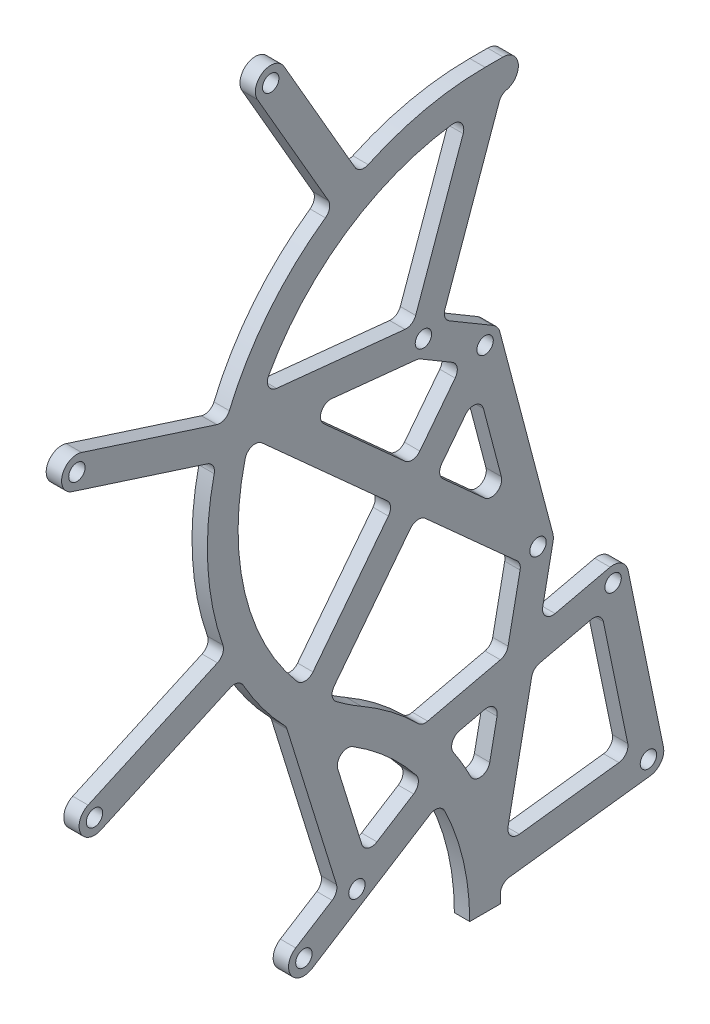
from build123d import *

# Parameters (mm, degrees)
SKETCH2_W             = 3
SKETCH2_H             = 6
SKETCH3_R             = 3
SKETCH3_R_2           = 1.6
BOSS_EXTRUDE1_DEPTH   = 3
BOSS_EXTRUDE1_2_DEPTH = 3
BOSS_EXTRUDE1_3_DEPTH = 3
SKETCH5_W             = 6.5
SKETCH5_H             = 6
BOSS_EXTRUDE2_DEPTH   = 3
FILLET1_R             = 3
SKETCH6_R             = 3
SKETCH6_R_2           = 1.6
BOSS_EXTRUDE3_DEPTH   = 3
BOSS_EXTRUDE3_2_DEPTH = 3
BOSS_EXTRUDE3_3_DEPTH = 3
BOSS_EXTRUDE3_4_DEPTH = 3
BOSS_EXTRUDE3_5_DEPTH = 3
BOSS_EXTRUDE3_6_DEPTH = 3
BOSS_EXTRUDE3_7_DEPTH = 3
BOSS_EXTRUDE4_START   = -3
SKETCH7_R             = 1.6
BOSS_EXTRUDE4_DEPTH   = 3
FILLET2_R             = 2
SKETCH8_R             = 1.6
BOSS_EXTRUDE7_DEPTH   = 3
FILLET3_R             = 2
BOSS_EXTRUDE8_START   = -3
BOSS_EXTRUDE8_DEPTH   = 3
FILLET4_R             = 2


with BuildPart() as part:
    # Sweep1: sweep along a path in Sketch1
    with BuildLine(Plane(origin=(0, 0, 0), x_dir=(0, 0, -1), z_dir=(1, 0, 0))) as sweep1_path:
        ThreePointArc((0, 140), (-49.497474683, 102.019251839), (-25.621778265, 44.378221735))
        ThreePointArc((-25.621778265, 44.378221735), (-6.865334795, 25.621778265), (0, 0))
    # Sketch2 → Sweep1 (sweep)
    with BuildSketch(Plane(origin=(0, 0, 0), x_dir=(1, 0, 0), z_dir=(0, 1, 0))):
        with Locations((1.5, 0)):
            Rectangle(SKETCH2_W, SKETCH2_H)
    sweep(path=sweep1_path.line)

    # Sketch5 → Boss-Extrude2 (add)
    with BuildSketch(Plane.ZY):
        with Locations((-3.25, 140)):
            Rectangle(SKETCH5_W, SKETCH5_H)
    extrude(amount=-BOSS_EXTRUDE2_DEPTH)

    # Fillet1
    fillet1_edges = [part.edges().sort_by_distance(p)[0] for p in [
        (1.5, 137, -6.5),
        (1.5, 143, -6.5),
    ]]
    fillet(fillet1_edges, radius=FILLET1_R - 0.0001)  # a hair under: the kernel refuses the full size



with BuildPart() as body_2:
    # Sketch3 → Boss-Extrude1 (new body)
    with BuildSketch(Plane.ZY):
        with Locations((0, 96)):
            Circle(SKETCH3_R)
        with Locations((0, 96)):
            Circle(SKETCH3_R_2, mode=Mode.SUBTRACT)
    extrude(amount=-BOSS_EXTRUDE1_DEPTH)


with BuildPart() as body_3:
    # Sketch3 → Boss-Extrude1 2 (new body)
    with BuildSketch(Plane.ZY):
        with Locations((-25, 43.301270189)):
            Circle(SKETCH3_R)
        with Locations((-25, 43.301270189)):
            Circle(SKETCH3_R_2, mode=Mode.SUBTRACT)
    extrude(amount=-BOSS_EXTRUDE1_2_DEPTH)


with BuildPart() as body_4:
    # Sketch3 → Boss-Extrude1 3 (new body)
    with BuildSketch(Plane.ZY):
        with Locations((25.032859693, 16.533479235)):
            Circle(SKETCH3_R)
        with Locations((25.032859693, 16.533479235)):
            Circle(SKETCH3_R_2, mode=Mode.SUBTRACT)
    extrude(amount=-BOSS_EXTRUDE1_3_DEPTH)


with BuildPart() as body_5:
    # Sketch6 → Boss-Extrude3 (new body)
    with BuildSketch(Plane.ZY):
        with Locations((12.048125899, 103.114840794)):
            Circle(SKETCH6_R)
        with Locations((12.048125899, 103.114840794)):
            Circle(SKETCH6_R_2, mode=Mode.SUBTRACT)
    extrude(amount=-BOSS_EXTRUDE3_DEPTH)


with BuildPart() as body_6:
    # Sketch6 → Boss-Extrude3 2 (new body)
    with BuildSketch(Plane.ZY):
        with Locations((41.871778265, 161.280490828)):
            Circle(SKETCH6_R)
        with Locations((41.871778265, 161.280490828)):
            Circle(SKETCH6_R_2, mode=Mode.SUBTRACT)
    extrude(amount=-BOSS_EXTRUDE3_2_DEPTH)


with BuildPart() as body_7:
    # Sketch6 → Boss-Extrude3 3 (new body)
    with BuildSketch(Plane.ZY):
        with Locations((79.721620809, 114.397161787)):
            Circle(SKETCH6_R)
        with Locations((79.721620809, 114.397161787)):
            Circle(SKETCH6_R_2, mode=Mode.SUBTRACT)
    extrude(amount=-BOSS_EXTRUDE3_3_DEPTH)


with BuildPart() as body_8:
    # Sketch6 → Boss-Extrude3 4 (new body)
    with BuildSketch(Plane.ZY):
        with Locations((76.299174561, 54.239502389)):
            Circle(SKETCH6_R)
        with Locations((76.299174561, 54.239502389)):
            Circle(SKETCH6_R_2, mode=Mode.SUBTRACT)
    extrude(amount=-BOSS_EXTRUDE3_4_DEPTH)


with BuildPart() as body_9:
    # Sketch6 → Boss-Extrude3 5 (new body)
    with BuildSketch(Plane.ZY):
        with Locations((35.390452374, 10)):
            Circle(SKETCH6_R)
        with Locations((35.390452374, 10)):
            Circle(SKETCH6_R_2, mode=Mode.SUBTRACT)
    extrude(amount=-BOSS_EXTRUDE3_5_DEPTH)


with BuildPart() as body_10:
    # Sketch6 → Boss-Extrude3 6 (new body)
    with BuildSketch(Plane.ZY):
        with Locations((-10.337645521, 56.751553408)):
            Circle(SKETCH6_R)
        with Locations((-10.337645521, 56.751553408)):
            Circle(SKETCH6_R_2, mode=Mode.SUBTRACT)
    extrude(amount=-BOSS_EXTRUDE3_6_DEPTH)


with BuildPart() as body_11:
    # Sketch6 → Boss-Extrude3 7 (new body)
    with BuildSketch(Plane.ZY):
        with Locations((-31.900795415, 10)):
            Circle(SKETCH6_R)
        with Locations((-31.900795415, 10)):
            Circle(SKETCH6_R_2, mode=Mode.SUBTRACT)
    extrude(amount=-BOSS_EXTRUDE3_7_DEPTH)


with BuildPart() as part_1:
    add(part.part)

    add(body_4.part)  # Boss-Extrude4 merges body 4

    add(body_6.part)  # Boss-Extrude4 merges body 6

    add(body_7.part)  # Boss-Extrude4 merges body 7

    add(body_8.part)  # Boss-Extrude4 merges body 8

    add(body_9.part)  # Boss-Extrude4 merges body 9
    # Sketch7 → Boss-Extrude4 (add)
    # profile 1 of 4: a face of its own
    with BuildSketch(Plane.ZY.offset(BOSS_EXTRUDE4_START)):
        with BuildLine():
            Line((39.273702054, 162.780490828), (24.482190705, 137.160841652))
            ThreePointArc((24.482190705, 137.160841652), (27.121778265, 135.732741417), (29.678343128, 134.160841652))
            Line((29.678343128, 134.160841652), (44.469854476, 159.780490828))
            ThreePointArc((44.469854476, 159.780490828), (40.371778265, 158.682414617), (39.273702054, 162.780490828))
        make_face()
    # profile 2 of 4: a face of its own
    with BuildSketch(Plane.ZY.offset(BOSS_EXTRUDE4_START)):
        with BuildLine():
            Line((78.803076647, 117.253081363), (50.640832104, 108.195310432))
            ThreePointArc((50.640832104, 108.195310432), (51.638411649, 105.364810861), (52.477920428, 102.483471281))
            Line((52.477920428, 102.483471281), (80.640164971, 111.541242212))
            ThreePointArc((80.640164971, 111.541242212), (76.865701234, 113.478617625), (78.803076647, 117.253081363))
        make_face()
    # profile 3 of 4: a face of its own
    with BuildSketch(Plane.ZY.offset(BOSS_EXTRUDE4_START)):
        with BuildLine():
            Line((77.535697435, 56.972817442), (50.582457015, 69.166178863))
            ThreePointArc((50.582457015, 69.166178863), (49.421576536, 66.398643988), (48.109411266, 63.699548757))
            Line((48.109411266, 63.699548757), (75.062651686, 51.506187336))
            ThreePointArc((75.062651686, 51.506187336), (73.565859507, 55.476025263), (77.535697435, 56.972817442))
        make_face()
    # profile 4 of 4: a face of its own
    with BuildSketch(Plane.ZY.offset(BOSS_EXTRUDE4_START)):
        with BuildLine():
            Line((26.633409725, 19.070847871), (36.991002405, 12.537368636))
            ThreePointArc((36.991002405, 12.537368636), (32.853083738, 11.600550032), (33.789902342, 7.462631364))
            Line((33.789902342, 7.462631364), (8.91807963, 23.151560463))
            ThreePointArc((8.91807963, 23.151560463), (10.439660785, 25.738741979), (12.119179694, 28.226297736))
            Line((12.119179694, 28.226297736), (26.633409725, 19.070847871))
        make_face()
        with Locations((25.032859693, 16.533479235)):
            Circle(SKETCH7_R, mode=Mode.SUBTRACT)
    extrude(amount=BOSS_EXTRUDE4_DEPTH)

    # Fillet2
    fillet2_edges = [part_1.edges().sort_by_distance(p)[0] for p in [
        (1.5, 28.226297736, 12.119179694),
        (1.5, 23.151560463, 8.91807963),
        (1.5, 134.160841652, 29.678343128),
        (1.5, 137.160841652, 24.482190705),
        (1.5, 102.483471281, 52.477920428),
        (1.5, 108.195310432, 50.640832104),
        (1.5, 63.699548757, 48.109411266),
        (1.5, 69.166178863, 50.582457015),
    ]]
    fillet(fillet2_edges, radius=FILLET2_R)


    add(body_2.part)  # Boss-Extrude7 merges body 2

    add(body_3.part)  # Boss-Extrude7 merges body 3

    add(body_5.part)  # Boss-Extrude7 merges body 5

    add(body_10.part)  # Boss-Extrude7 merges body 10

    add(body_11.part)  # Boss-Extrude7 merges body 11
    # Sketch8 → Boss-Extrude7 (add)
    with BuildSketch(Plane.ZY):
        with BuildLine():
            Line((8.393057458, 104.440441929), (-3.183740882, 137))
            Line((-3.183740882, 137), (0, 137))
            ThreePointArc((0, 137), (1.611919949, 136.973063641), (3.222039895, 136.892284644))
            Line((3.222039895, 136.892284644), (14.085757994, 106.338253219))
            Line((14.085757994, 106.338253219), (43.626634647, 109.351527739))
            ThreePointArc((43.626634647, 109.351527739), (44.894446443, 106.417967334), (45.965255364, 103.406905783))
            Line((45.965255364, 103.406905783), (17.749481479, 78.00292457))
            Line((17.749481479, 78.00292457), (35.085165165, 55.64342591))
            ThreePointArc((35.085165165, 55.64342591), (32.948761859, 53.516979249), (30.683731318, 51.528102397))
            Line((30.683731318, 51.528102397), (13.27841441, 73.977413723))
            Line((13.27841441, 73.977413723), (-7.060176196, 55.665629125))
            Line((-7.060176196, 55.665629125), (-4.235299675, 41.577948329))
            Line((-4.235299675, 41.577948329), (12.29552278, 37.754656561))
            ThreePointArc((12.29552278, 37.754656561), (10.017040747, 35.25248674), (7.899021501, 32.613106385))
            Line((7.899021501, 32.613106385), (-2.940358436, 35.120066471))
            Line((-2.940358436, 35.120066471), (0.342699526, 18.747431326))
            ThreePointArc((0.342699526, 18.747431326), (-1.831079393, 11.200287796), (-2.892183905, 3.418337688))
            Line((-2.892183905, 3.418337688), (-32.266136125, 7.022328735))
            ThreePointArc((-32.266136125, 7.022328735), (-34.3386059, 8.251549247), (-34.838386155, 10.608736922))
            Line((-34.838386155, 10.608736922), (-27.937590741, 43.910007111))
            ThreePointArc((-27.937590741, 43.910007111), (-26.655895697, 45.803353823), (-24.412500996, 46.24458412))
            Line((-24.412500996, 46.24458412), (-10.652340269, 43.062098228))
            Line((-10.652340269, 43.062098228), (-13.279092442, 56.161731388))
            ThreePointArc((-13.279092442, 56.161731388), (-13.334191648, 56.895467664), (-13.209030344, 57.62054662))
            Line((-13.209030344, 57.62054662), (-2.871384822, 96.868993212))
            ThreePointArc((-2.871384822, 96.868993212), (-2.359600691, 97.852642594), (-1.525471744, 98.583202655))
            Line((-1.525471744, 98.583202655), (8.393057458, 104.440441929))
        make_face()
        with Locations((-31.900795415, 10)):
            Circle(SKETCH8_R, mode=Mode.SUBTRACT)
        with Locations((-25, 43.301270189)):
            Circle(SKETCH8_R, mode=Mode.SUBTRACT)
        with Locations((-10.337645521, 56.751553408)):
            Circle(SKETCH8_R, mode=Mode.SUBTRACT)
        with Locations((0, 96)):
            Circle(SKETCH8_R, mode=Mode.SUBTRACT)
        with Locations((12.048125899, 103.114840794)):
            Circle(SKETCH8_R, mode=Mode.SUBTRACT)
        Polygon((13.007082489, 100.197091076), (36.042793369, 102.546815544), (14.063162087, 82.757525254), (4.456760087, 95.147825893), align=None, mode=Mode.SUBTRACT)
        Polygon((-28.302222418, 12.580974896), (-3.940880735, 9.591998246), (-9.357399029, 36.60421637), (-22.685611431, 39.685137358), align=None, mode=Mode.SUBTRACT)
        Polygon((-4.877171693, 65.704656689), (1.353061884, 89.3586879), (9.592095018, 78.732014407), align=None, mode=Mode.SUBTRACT)
    extrude(amount=-BOSS_EXTRUDE7_DEPTH)

    # Fillet3
    fillet3_edges = [part_1.edges().sort_by_distance(p)[0] for p in [
        (1.5, 43.062098228, -10.652340269),
        (1.5, 12.580974896, -28.302222418),
        (1.5, 9.591998246, -3.940880735),
        (1.5, 3.418337688, -2.892183905),
        (1.5, 39.685137358, -22.685611431),
        (1.5, 36.60421637, -9.357399029),
        (1.5, 35.120066471, -2.940358436),
        (1.5, 32.613106385, 7.899021501),
        (1.5, 18.747431326, 0.342699526),
        (1.5, 41.577948329, -4.235299675),
        (1.5, 37.754656561, 12.29552278),
        (1.5, 55.64342591, 35.085165165),
        (1.5, 51.528102397, 30.683731318),
        (1.5, 55.665629125, -7.060176196),
        (1.5, 78.00292457, 17.749481479),
        (1.5, 73.977413723, 13.27841441),
        (1.5, 103.406905783, 45.965255364),
        (1.5, 78.732014407, 9.592095018),
        (1.5, 89.3586879, 1.353061884),
        (1.5, 65.704656689, -4.877171693),
        (1.5, 82.757525254, 14.063162087),
        (1.5, 100.197091076, 13.007082489),
        (1.5, 95.147825893, 4.456760087),
        (1.5, 102.546815544, 36.042793369),
        (1.5, 104.440441929, 8.393057458),
        (1.5, 109.351527739, 43.626634647),
        (1.5, 106.338253219, 14.085757994),
        (1.5, 136.892284644, 3.222039895),
        (1.5, 137, -3.183740882),
    ]]
    fillet(fillet3_edges, radius=FILLET3_R)

    # Sketch10 → Boss-Extrude8 (add)
    with BuildSketch(Plane.ZY.offset(BOSS_EXTRUDE8_START)):
        with BuildLine():
            Line((30.355249084, 43.801774324), (22.167696965, 17.422772519))
            ThreePointArc((22.167696965, 17.422772519), (25.482588399, 19.499578372), (28.032859693, 16.533479235))
            ThreePointArc((28.032859693, 16.533479235), (27.99895883, 16.083750529), (27.89802242, 15.64418595))
            Line((27.89802242, 15.64418595), (38.836878349, 50.887454771))
            ThreePointArc((38.836878349, 50.887454771), (34.776994429, 47.128038702), (30.355249084, 43.801774324))
        make_face()
    extrude(amount=BOSS_EXTRUDE8_DEPTH)

    # Fillet4
    fillet4_edges = [part_1.edges().sort_by_distance(p)[0] for p in [
        (1.5, 43.801774324, 30.355249084),
        (1.5, 50.887454771, 38.836878349),
        (1.5, 17.842702636, 28.580401158),
        (1.5, 21.156725283, 23.326646538),
    ]]
    fillet(fillet4_edges, radius=FILLET4_R)


solid = part_1.part
